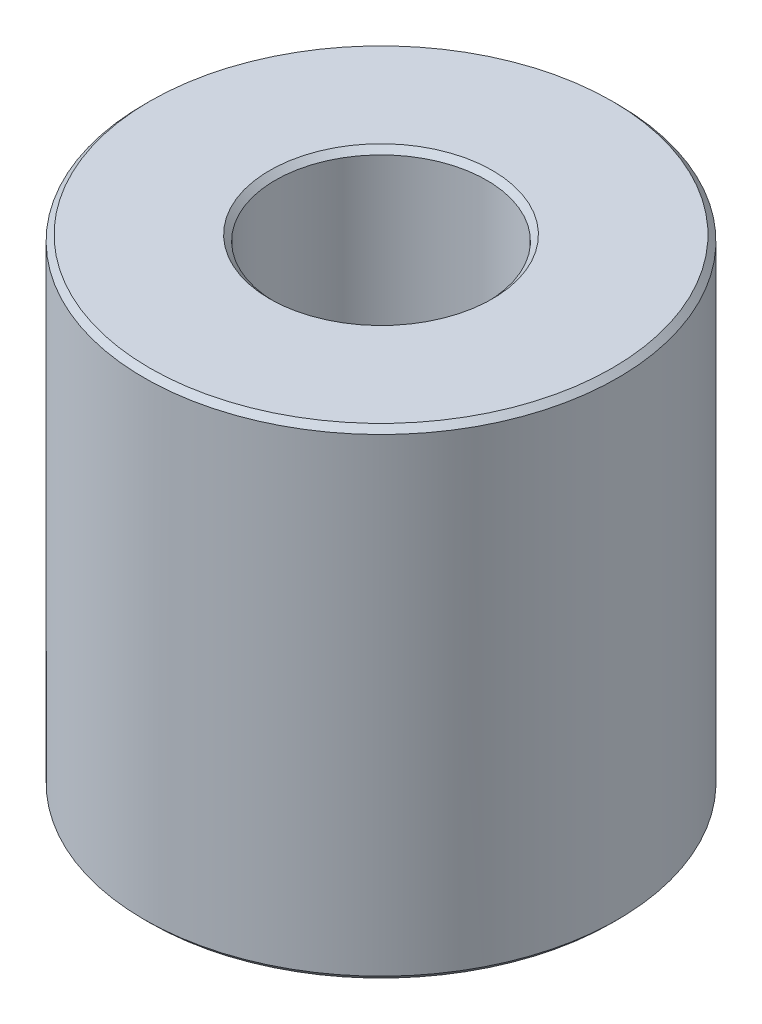
from build123d import *

# Parameters (mm, degrees)
SKETCH1_R           = 35
BOSS_EXTRUDE1_DEPTH = 70.9918937
SKETCH2_R           = 15.618310769
CUT_EXTRUDE1_DEPTH  = 87.543913542
CHAMFER1_SIZE       = 0.83406324


with BuildPart() as part:
    # Sketch1 → Boss-Extrude1 (new body)
    with BuildSketch(Plane(origin=(0, 0, 0), x_dir=(1, 0, 0), z_dir=(0, 1, 0))):
        Circle(SKETCH1_R)
    extrude(amount=BOSS_EXTRUDE1_DEPTH)

    # Sketch2 → Cut-Extrude1 (cut, through all)
    with BuildSketch(Plane(origin=(0, 0, 0), x_dir=(1, 0, 0), z_dir=(0, 1, 0))):
        Circle(SKETCH2_R)
    extrude(amount=CUT_EXTRUDE1_DEPTH, mode=Mode.SUBTRACT)

    # Chamfer1
    chamfer1_edges = [part.edges().sort_by_distance(p)[0] for p in [
        (-15.618310769, 70.9918937, 0),
        (-15.618310769, 0, 0),
        (-35, 0, 0),
        (-35, 70.9918937, 0),
    ]]
    chamfer(chamfer1_edges, length=CHAMFER1_SIZE)


solid = part.part
